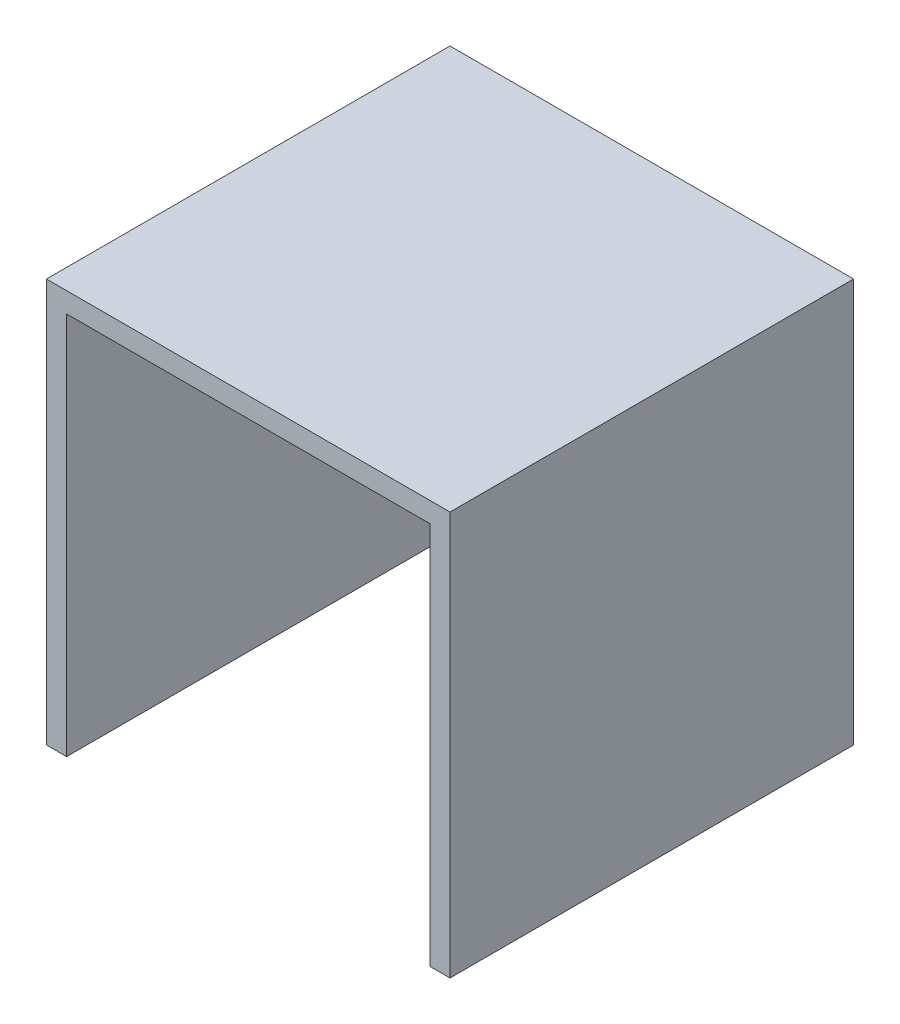
from build123d import *

# Parameters (mm, degrees)
BOSS_EXTRUDE1_DEPTH = 40


with BuildPart() as part:
    # Sketch1 → Boss-Extrude1 (new body)
    with BuildSketch(Plane.XY):
        Polygon((2, -2), (2, -40), (0, -40), (0, 0), (40, 0), (40, -40), (38, -40), (38, -2), align=None)
    extrude(amount=BOSS_EXTRUDE1_DEPTH)


solid = part.part
